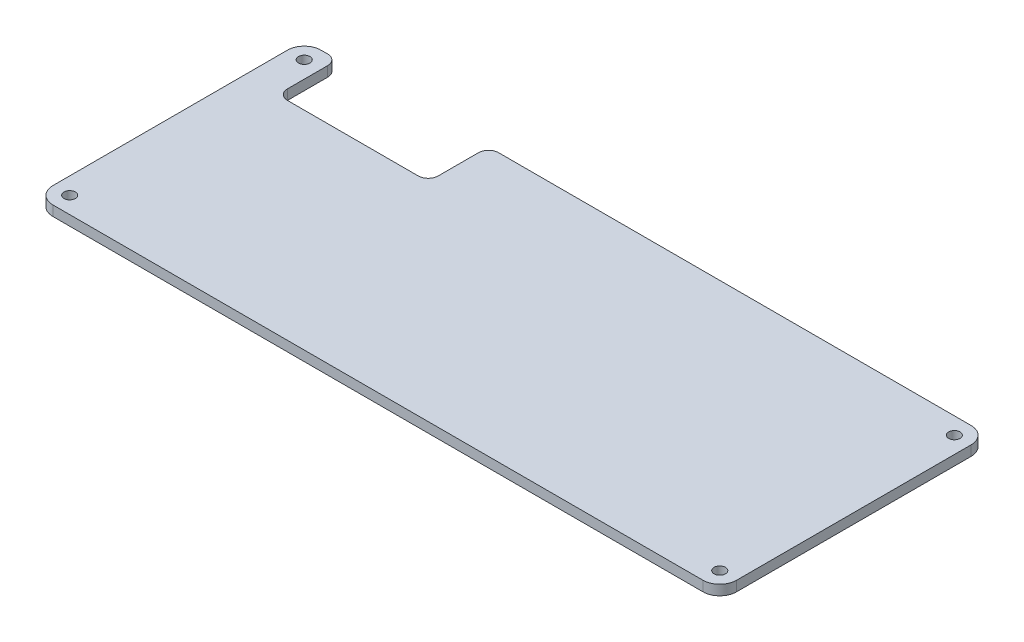
from build123d import *

# Parameters (mm, degrees)
ESQUISSE1_W             = 204
ESQUISSE1_H             = 80
BOSS_EXTRU_1_DEPTH      = 3
CONG_1_R                = 5
ESQUISSE2_R             = 1
ESQUISSE2_W             = 45
ESQUISSE2_H             = 18
ENL_V_MAT_EXTRU_1_DEPTH = 220.146070008
D_GAGEMENT_M31_D        = 3.4
D_GAGEMENT_M31_DEPTH    = 10
D_GAGEMENT_M31_TIP      = 1.021463052
CONG_2_R                = 3


with BuildPart() as part:
    # Esquisse1 → Boss.-Extru.1 (new body)
    with BuildSketch(Plane(origin=(0, 0, 0), x_dir=(1, 0, 0), z_dir=(0, 1, 0))):
        with Locations((102, 40)):
            Rectangle(ESQUISSE1_W, ESQUISSE1_H)
    extrude(amount=BOSS_EXTRU_1_DEPTH)

    # Congé1
    cong_1_edges = [part.edges().sort_by_distance(p)[0] for p in [
        (0, 1.5, -80),
        (0, 1.5, 0),
        (204, 1.5, -80),
        (204, 1.5, 0),
    ]]
    fillet(cong_1_edges, radius=CONG_1_R)

    # Esquisse2 → Enlèv. mat.-Extru.1 (cut, through all)
    with BuildSketch(Plane(origin=(0, 3, 0), x_dir=(1, 0, 0), z_dir=(0, 1, 0))):
        with Locations((5, 75)):
            Circle(ESQUISSE2_R)
        with Locations((199, 75)):
            Circle(ESQUISSE2_R)
        with Locations((199, 5)):
            Circle(ESQUISSE2_R)
        with Locations((5, 5)):
            Circle(ESQUISSE2_R)
        with Locations((32.5, 71)):
            Rectangle(ESQUISSE2_W, ESQUISSE2_H)
    extrude(amount=-ENL_V_MAT_EXTRU_1_DEPTH, mode=Mode.SUBTRACT)

    # Dégagement M31
    with Locations(Plane(origin=(0, 3, 0), x_dir=(1, 0, 0), z_dir=(0, 1, 0))):
        with Locations((199, 5), (5, 5), (5, 75), (199, 75)):
            Hole(D_GAGEMENT_M31_D / 2, depth=D_GAGEMENT_M31_DEPTH)
            with Locations((0, 0, -(D_GAGEMENT_M31_DEPTH + D_GAGEMENT_M31_TIP / 2))):  # 118° drill point
                Cone(0, D_GAGEMENT_M31_D / 2, D_GAGEMENT_M31_TIP, mode=Mode.SUBTRACT)

    # Congé2
    cong_2_edges = [part.edges().sort_by_distance(p)[0] for p in [
        (55, 1.5, -62),
        (55, 1.5, -80),
        (10, 1.5, -80),
        (10, 1.5, -62),
    ]]
    fillet(cong_2_edges, radius=CONG_2_R)


solid = part.part
